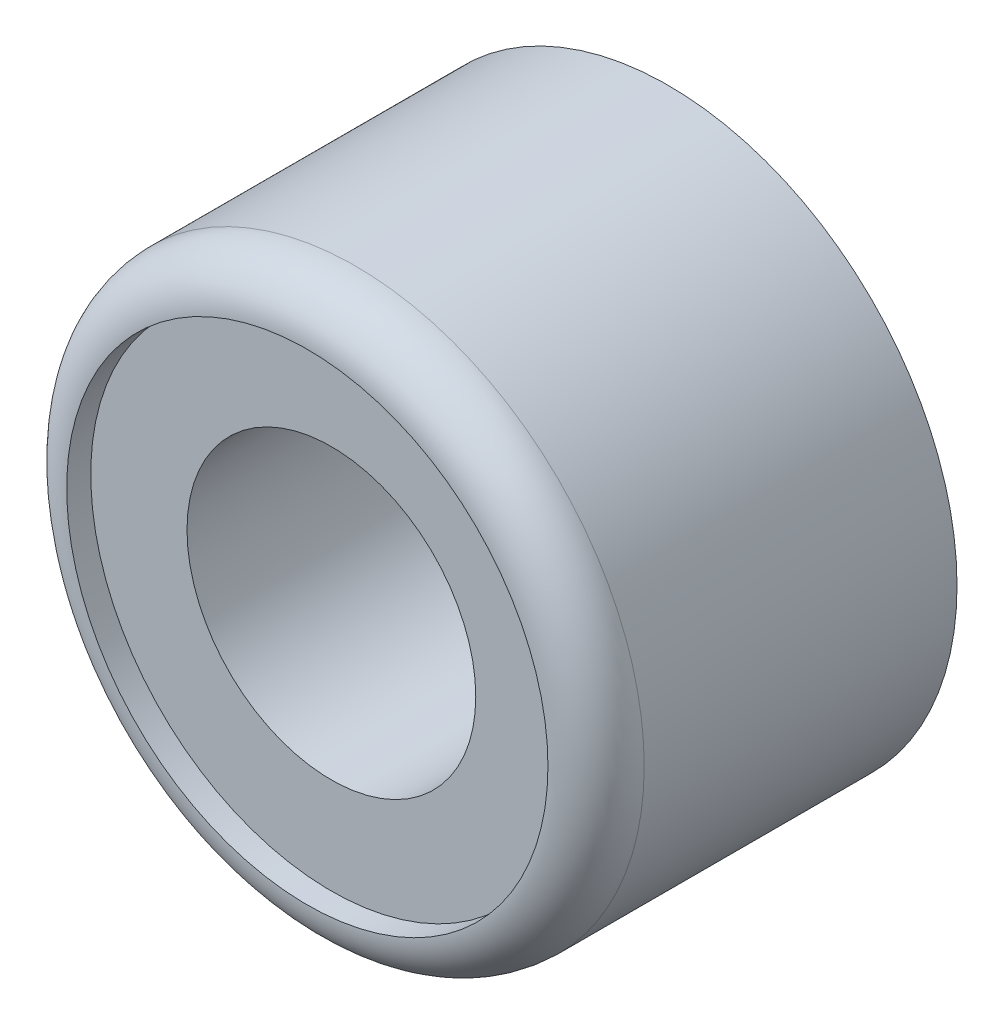
from build123d import *

# Parameters (mm, degrees)
SKETCH1_R           = 3
SKETCH1_R_2         = 1.55
BOSS_EXTRUDE1_DEPTH = 1.5
SKETCH1_7_R         = 5
SKETCH1_7_R_2       = 3
BOSS_EXTRUDE3_DEPTH = 7
SKETCH1_9_R         = 6
SKETCH1_9_R_2       = 5
BOSS_EXTRUDE4_DEPTH = 7.5
FILLET1_R           = 1


with BuildPart() as part:
    # Sketch1 → Boss-Extrude1 (new body)
    with BuildSketch(Plane.XY):
        Circle(SKETCH1_R)
        Circle(SKETCH1_R_2, mode=Mode.SUBTRACT)
    extrude(amount=BOSS_EXTRUDE1_DEPTH)

    # Sketch1<7> → Boss-Extrude3 (add)
    with BuildSketch(Plane.XY):
        Circle(SKETCH1_7_R)
        Circle(SKETCH1_7_R_2, mode=Mode.SUBTRACT)
    extrude(amount=BOSS_EXTRUDE3_DEPTH)

    # Sketch1<9> → Boss-Extrude4 (add)
    with BuildSketch(Plane.XY):
        Circle(SKETCH1_9_R)
        Circle(SKETCH1_9_R_2, mode=Mode.SUBTRACT)
    extrude(amount=BOSS_EXTRUDE4_DEPTH)

    # Fillet1
    fillet1_edges = [part.edges().sort_by_distance(p)[0] for p in [
        (-6, 0, 7.5),
    ]]
    fillet(fillet1_edges, radius=FILLET1_R - 0.0001)  # a hair under: the kernel refuses the full size


solid = part.part
